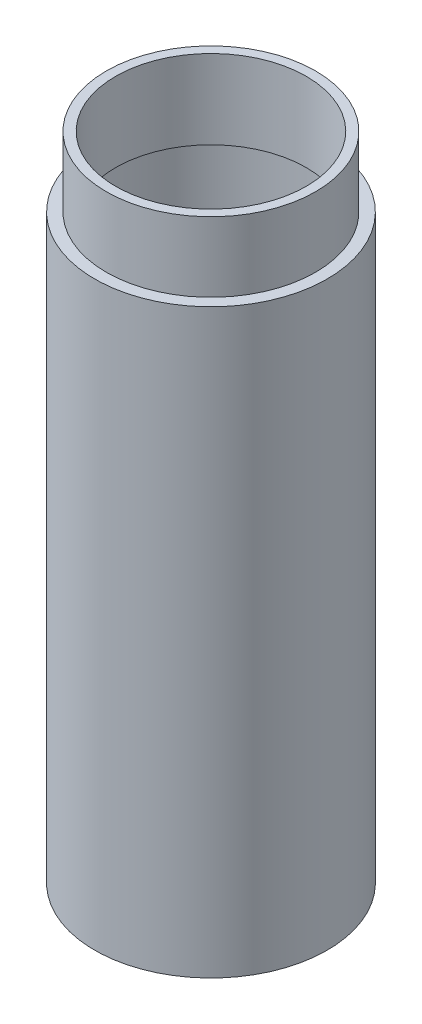
from build123d import *

# Parameters (mm, degrees)
SKETCH2_R           = 31.75
BOSS_EXTRUDE1_DEPTH = 158.75
SKETCH3_R           = 28.575
BOSS_EXTRUDE2_DEPTH = 19.05
SKETCH4_R           = 25.4
CUT_EXTRUDE1_DEPTH  = 6.35
SKETCH5_R           = 6.35
CUT_EXTRUDE2_DEPTH  = 5.08
DRAFT2_ANGLE        = 45


# Read off the part's stored shape, not the designer's step: Draft3, Shell1
with BuildPart() as part:
    # Sketch2 → Boss-Extrude1 (new body)
    with BuildSketch(Plane(origin=(0, 0, 0), x_dir=(1, 0, 0), z_dir=(0, 1, 0))):
        with Locations(Location((0, 0, 0), (0, 0, 90))):
            Circle(SKETCH2_R)
    extrude(amount=BOSS_EXTRUDE1_DEPTH)

    # Sketch3 → Boss-Extrude2 (add)
    with BuildSketch(Plane(origin=(0, 158.75, 0), x_dir=(1, 0, 0), z_dir=(0, 1, 0))):
        with Locations(Location((0, 0, 0), (0, 0, 90))):
            Circle(SKETCH3_R)
    extrude(amount=BOSS_EXTRUDE2_DEPTH)

    # Sketch4 → Cut-Extrude1 (cut)
    with BuildSketch(Plane.XZ):
        with Locations(Location((0, 0, 0), (0, 0, 270))):
            Circle(SKETCH4_R)
    extrude(amount=-CUT_EXTRUDE1_DEPTH, mode=Mode.SUBTRACT)

    # Sketch5 → Cut-Extrude2 (cut)
    with BuildSketch(Plane.XZ.offset(-6.35)):
        with Locations(Location((0, 0, 0), (0, 0, 270))):
            Circle(SKETCH5_R)
    extrude(amount=-CUT_EXTRUDE2_DEPTH, mode=Mode.SUBTRACT)

    # Draft2
    draft2_faces = [part.faces().sort_by_distance(p)[0] for p in [
        (0, 3.175, 25.4),
    ]]
    draft(draft2_faces, Plane(origin=(0, 0, 0), x_dir=(0, 0, -1), z_dir=(0, -1, 0)), DRAFT2_ANGLE)

    # Draft3 outline → Draft3 (revolve)
    with BuildSketch(Plane.XY):
        Polygon((6.35, 6.35), (6.35, 11.43), (0, 11.43), (0, 10.016174209), align=None)
    revolve(axis=Axis((0, 0, 0), (0, 1, 0)))

    # Shell1 outline → Shell1 (revolve, cut)
    with BuildSketch(Plane.XY):
        Polygon((29.21, 156.21), (26.035, 156.21), (26.035, 177.8), (0, 177.8), (0, 15.882052944), (7.711181898, 11.43), (21.154204897, 11.43), (27.504204897, 5.08), (29.21, 5.08), align=None)
    revolve(axis=Axis((0, 0, 0), (0, 1, 0)), mode=Mode.SUBTRACT)


solid = part.part
